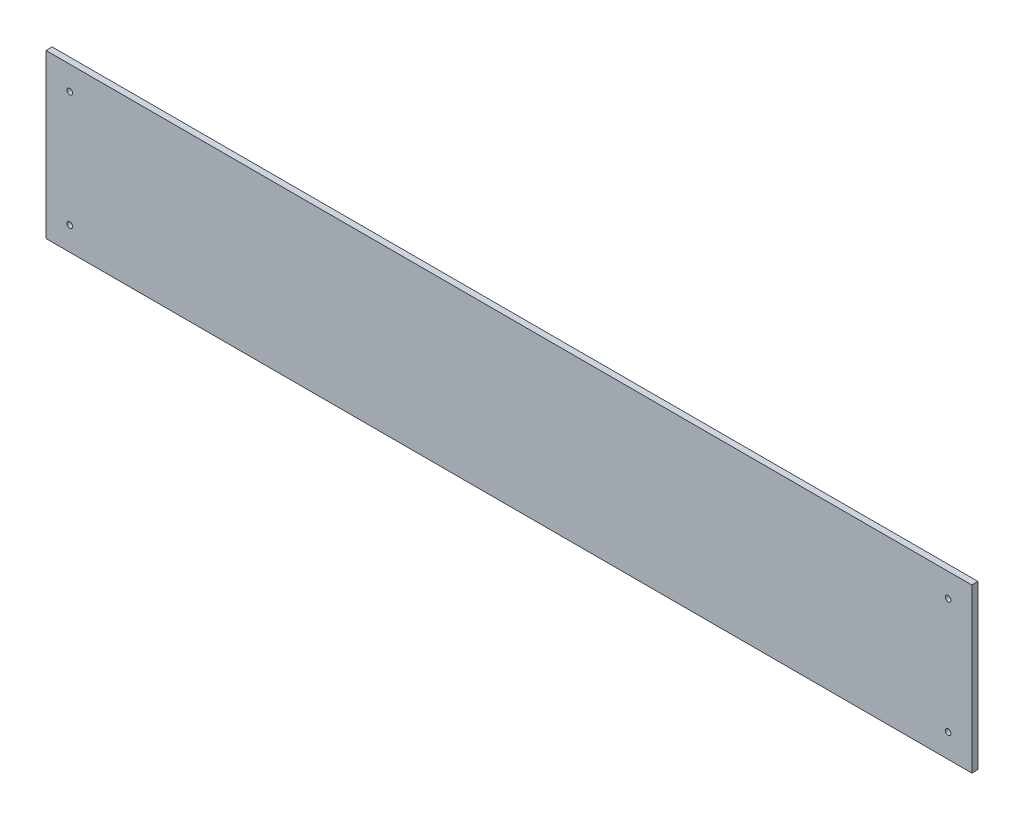
from build123d import *

# Parameters (mm, degrees)
SKETCH_F_W                   = 449
SKETCH_F_H                   = 79
SKETCH_F_R                   = 1.361667817
ESTRUSIONE_ESTRUSIONE1_DEPTH = 3


with BuildPart() as part:
    # Sketch f → Estrusione-Estrusione1 (new body)
    with BuildSketch(Plane.XY):
        with Locations((224.5, 39.5)):
            Rectangle(SKETCH_F_W, SKETCH_F_H)
        with Locations((11.5, 67.5)):
            Circle(SKETCH_F_R, mode=Mode.SUBTRACT)
        with Locations((437.5, 67.5)):
            Circle(SKETCH_F_R, mode=Mode.SUBTRACT)
        with Locations((11.5, 11.5)):
            Circle(SKETCH_F_R, mode=Mode.SUBTRACT)
        with Locations((437.5, 11.5)):
            Circle(SKETCH_F_R, mode=Mode.SUBTRACT)
    extrude(amount=ESTRUSIONE_ESTRUSIONE1_DEPTH)


solid = part.part
